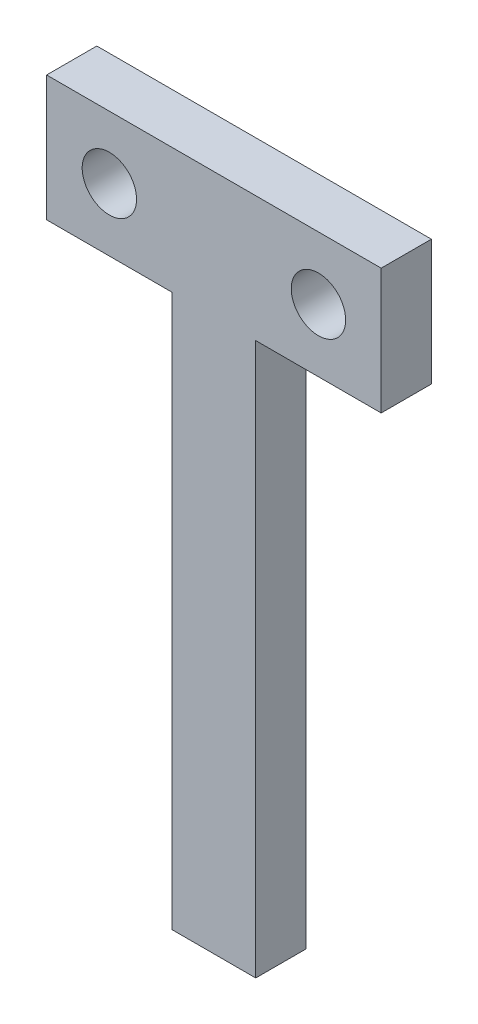
from build123d import *

# Parameters (mm, degrees)
SKETCH1_R           = 1.625
BOSS_EXTRUDE1_DEPTH = 3


with BuildPart() as part:
    # Sketch1 → Boss-Extrude1 (new body)
    with BuildSketch(Plane.XY):
        Polygon((0, 0), (0, 33), (-7.5, 33), (-7.5, 40.5), (12.5, 40.5), (12.5, 33), (5, 33), (5, 0), align=None)
        with Locations((-3.75, 36.75)):
            Circle(SKETCH1_R, mode=Mode.SUBTRACT)
        with Locations((8.75, 36.75)):
            Circle(SKETCH1_R, mode=Mode.SUBTRACT)
    extrude(amount=BOSS_EXTRUDE1_DEPTH)


solid = part.part
